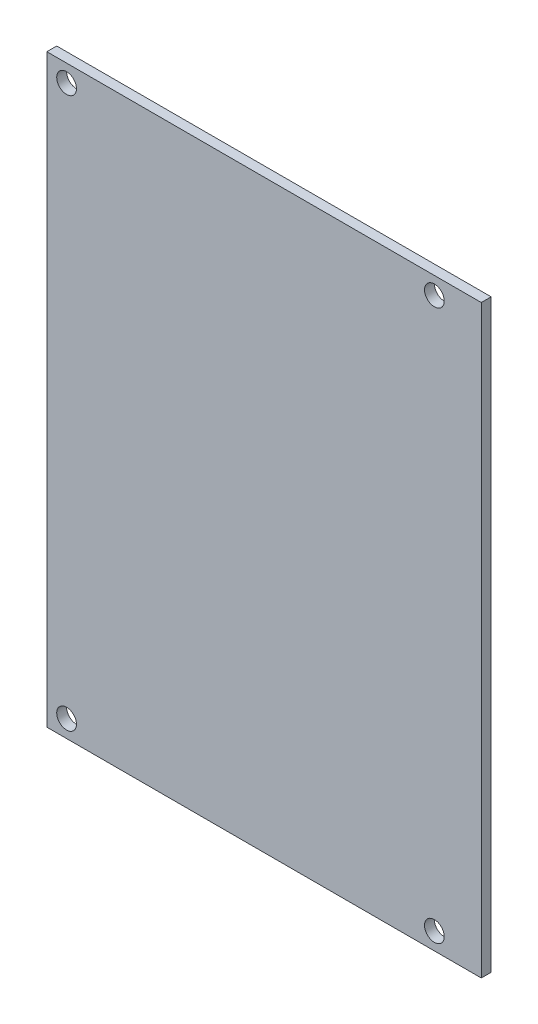
from build123d import *

# Parameters (mm, degrees)
MAIN_SKETCH_W        = 88
MAIN_SKETCH_H        = 118.5
MAIN_EXTRUSION_DEPTH = 2
FIX_SKETCH_R         = 2
FIX_HOLE_DEPTH       = 148.615209243


with BuildPart() as part:
    # Main-Sketch → Main-Extrusion (new body)
    with BuildSketch(Plane.XY):
        with Locations((44, 59.25)):
            Rectangle(MAIN_SKETCH_W, MAIN_SKETCH_H)
    extrude(amount=MAIN_EXTRUSION_DEPTH)

    # Fix-Sketch → Fix-Hole (cut, through all)
    with BuildSketch(Plane.XY.offset(2)):
        with Locations((4, 115)):
            Circle(FIX_SKETCH_R)
        with Locations((4, 3.5)):
            Circle(FIX_SKETCH_R)
        with Locations((78.5, 3.5)):
            Circle(FIX_SKETCH_R)
        with Locations((78.5, 115)):
            Circle(FIX_SKETCH_R)
    extrude(amount=-FIX_HOLE_DEPTH, mode=Mode.SUBTRACT)


solid = part.part
